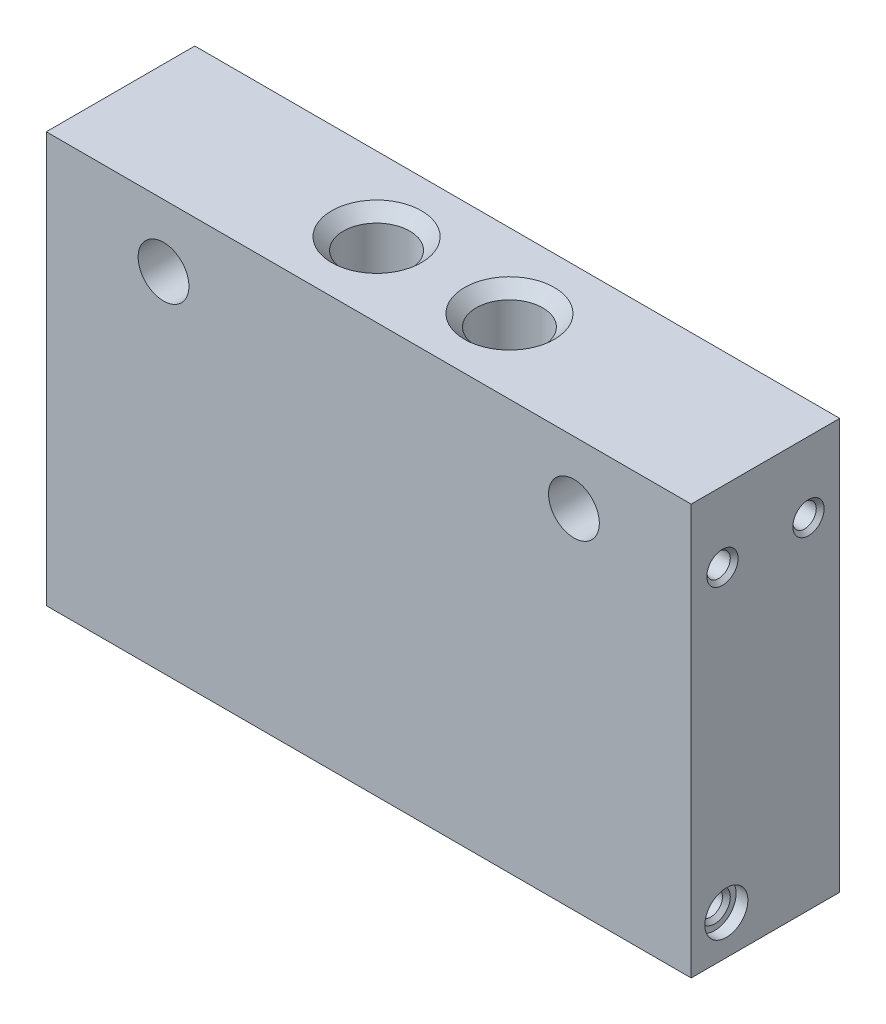
from build123d import *

# Parameters (mm, degrees)
SKETCH1_W                = 41.91
SKETCH1_H                = 9.652
BOSS_EXTRUDE1_DEPTH      = 26.67
SKETCH2_R                = 1.651
CUT_EXTRUDE1_DEPTH       = 51.605316954
SKETCH3_R                = 2.159
CUT_EXTRUDE2_DEPTH       = 6.35
CHAMFER5_SIZE            = 0.762
SKETCH5_R                = 2.159
CUT_EXTRUDE4_DEPTH       = 5.08
SKETCH6_R                = 2.921
CUT_EXTRUDE5_DEPTH       = 0.762
CHAMFER2_SIZE            = 0.762
SKETCH7_R                = 0.762
CUT_EXTRUDE6_DEPTH       = 5.334
SKETCH9_R                = 1.016
CUT_EXTRUDE7_DEPTH       = 1.27
SKETCH10_R               = 1.397
CUT_EXTRUDE8_DEPTH       = 0.762
CHAMFER3_SIZE            = 0.508
CHAMFER3_OF_MIRROR2_SIZE = 0.508
SKETCH12_R               = 0.762
CUT_EXTRUDE9_DEPTH       = 4.572
SKETCH14_R               = 1.016
CUT_EXTRUDE10_DEPTH      = 0.254
CHAMFER4_SIZE            = 0.254
CHAMFER4_OF_MIRROR3_SIZE = 0.254


# Some blends are built 0.0001 mm under size
with BuildPart() as part:
    # Sketch1 → Boss-Extrude1 (new body)
    with BuildSketch(Plane(origin=(0, 0, 0), x_dir=(1, 0, 0), z_dir=(0, 1, 0))):
        with Locations((20.955, 4.826)):
            Rectangle(SKETCH1_W, SKETCH1_H)
    extrude(amount=BOSS_EXTRUDE1_DEPTH)

    # Sketch2 → Cut-Extrude1 (cut, through all)
    with BuildSketch(Plane.XY):
        with Locations((34.29, 22.606)):
            Circle(SKETCH2_R)
        with Locations(Location((7.62, 22.606, 0), (0, 0, 180))):
            Circle(SKETCH2_R)
    extrude(amount=-CUT_EXTRUDE1_DEPTH, mode=Mode.SUBTRACT)

    # Sketch3 → Cut-Extrude2 (cut)
    with BuildSketch(Plane(origin=(0, 26.67, 0), x_dir=(1, 0, 0), z_dir=(0, 1, 0))):
        with Locations(Location((25.273, 4.826, 0), (0, 0, 270))):
            Circle(SKETCH3_R)
        with Locations(Location((16.637, 4.826, 0), (0, 0, 90))):
            Circle(SKETCH3_R)
    extrude(amount=-CUT_EXTRUDE2_DEPTH, mode=Mode.SUBTRACT)

    # Chamfer5
    chamfer5_edges = [part.edges().sort_by_distance(p)[0] for p in [
        (25.273, 26.67, -6.985),
        (16.637, 26.67, -2.667),
    ]]
    chamfer(chamfer5_edges, length=CHAMFER5_SIZE)

    # Sketch5 → Cut-Extrude4 (cut)
    with BuildSketch(Plane(origin=(0, 0, 0), x_dir=(-1, 0, 0), z_dir=(0, -1, 0))):
        with Locations(Location((-33.401, 4.826, 0), (0, 0, 90))):
            Circle(SKETCH5_R)
        with Locations(Location((-8.509, 4.826, 0), (0, 0, 270))):
            Circle(SKETCH5_R)
        with Locations(Location((-20.955, 4.826, 0), (0, 0, 90))):
            Circle(SKETCH5_R)
    extrude(amount=-CUT_EXTRUDE4_DEPTH, mode=Mode.SUBTRACT)

    # Sketch6 → Cut-Extrude5 (cut)
    with BuildSketch(Plane(origin=(0, 0, 0), x_dir=(-1, 0, 0), z_dir=(0, -1, 0))):
        with Locations(Location((-33.401, 4.826, 0), (0, 0, 90))):
            Circle(SKETCH6_R)
        with Locations(Location((-20.955, 4.826, 0), (0, 0, 90))):
            Circle(SKETCH6_R)
        with Locations(Location((-8.509, 4.826, 0), (0, 0, 90))):
            Circle(SKETCH6_R)
    extrude(amount=-CUT_EXTRUDE5_DEPTH, mode=Mode.SUBTRACT)

    # Chamfer2
    chamfer2_edges = [part.edges().sort_by_distance(p)[0] for p in [
        (33.401, 0.762, -1.905),
        (20.955, 0.762, -1.905),
        (8.509, 0.762, -1.905),
    ]]
    chamfer(chamfer2_edges, length=CHAMFER2_SIZE - 0.0001)  # a hair under: the kernel refuses the full size

    # Sketch7 → Cut-Extrude6 (cut)
    with BuildSketch(Plane(origin=(41.91, 0, 0), x_dir=(0, 0, -1), z_dir=(1, 0, 0))):
        with Locations((2.286, 2.54)):
            Circle(SKETCH7_R)
    cut_extrude6 = extrude(amount=-CUT_EXTRUDE6_DEPTH, mode=Mode.SUBTRACT)

    # Sketch9 → Cut-Extrude7 (cut)
    with BuildSketch(Plane(origin=(41.91, 0, 0), x_dir=(0, 0, -1), z_dir=(1, 0, 0))):
        with Locations((2.286, 2.54)):
            Circle(SKETCH9_R)
    cut_extrude7 = extrude(amount=-CUT_EXTRUDE7_DEPTH, mode=Mode.SUBTRACT)

    # Sketch10 → Cut-Extrude8 (cut)
    with BuildSketch(Plane(origin=(41.91, 0, 0), x_dir=(0, 0, -1), z_dir=(1, 0, 0))):
        with Locations((2.286, 2.54)):
            Circle(SKETCH10_R)
    cut_extrude8 = extrude(amount=-CUT_EXTRUDE8_DEPTH, mode=Mode.SUBTRACT)

    # Chamfer3
    # the kernel refuses this chamfer: 0.508 mm, written as the material it adds along each edge
    with BuildSketch(Plane(origin=(40.64, 2.54, -2.286), x_dir=(0, 0, -1), z_dir=(0, -1, 0))) as chamfer3_piece_1_section:
        Polygon((1.016, CHAMFER3_SIZE), (1.016 - CHAMFER3_SIZE, 0), (1.016, 0), align=None)
    chamfer3_piece_1 = revolve(axis=Axis((40.64, 2.54, -2.286), (1, 0, 0)), mode=Mode.PRIVATE)
    chamfer3_piece_1 = split(chamfer3_piece_1, bisect_by=Plane(origin=(41.148, 2.54, -1.391029136), z_dir=(-1, 0, 0)), keep=Keep.TOP, mode=Mode.PRIVATE)
    chamfer3_piece_1 = chamfer3_piece_1 - Plane(origin=(41.015029136, 2.54, -2.286), x_dir=(0, 0, -1), z_dir=(1, 0, 0)) * Cylinder(0.762, 5, mode=Mode.PRIVATE)
    add(chamfer3_piece_1)

    # Mirror2: Cut-Extrude6, Cut-Extrude7, Cut-Extrude8 across plane
    add(cut_extrude6.mirror(Plane.ZY.offset(-20.955)), mode=Mode.SUBTRACT)
    add(cut_extrude7.mirror(Plane.ZY.offset(-20.955)), mode=Mode.SUBTRACT)
    add(cut_extrude8.mirror(Plane.ZY.offset(-20.955)), mode=Mode.SUBTRACT)

    # Chamfer3 of Mirror2
    # the kernel refuses this chamfer: 0.508 mm, written as the material it adds along each edge
    with BuildSketch(Plane(origin=(1.27, 2.54, -2.286), x_dir=(0, 0, -1), z_dir=(0, -1, 0))) as chamfer3_of_mirror2_piece_1_section:
        Polygon((1.016, -CHAMFER3_OF_MIRROR2_SIZE), (1.016 - CHAMFER3_OF_MIRROR2_SIZE, 0), (1.016, 0), align=None)
    chamfer3_of_mirror2_piece_1 = revolve(axis=Axis((1.27, 2.54, -2.286), (1, 0, 0)), mode=Mode.PRIVATE)
    chamfer3_of_mirror2_piece_1 = split(chamfer3_of_mirror2_piece_1, bisect_by=Plane(origin=(0.762, 2.54, -1.391029136), z_dir=(1, 0, 0)), keep=Keep.TOP, mode=Mode.PRIVATE)
    chamfer3_of_mirror2_piece_1 = chamfer3_of_mirror2_piece_1 - Plane(origin=(0.894970864, 2.54, -2.286), x_dir=(0, 0, -1), z_dir=(-1, 0, 0)) * Cylinder(0.762, 5, mode=Mode.PRIVATE)
    add(chamfer3_of_mirror2_piece_1)

    # Sketch12 → Cut-Extrude9 (cut)
    with BuildSketch(Plane.ZY):
        with Locations((-2.032, 22.098)):
            Circle(SKETCH12_R)
        with Locations(Location((-7.62, 22.098, 0), (0, 0, 180))):
            Circle(SKETCH12_R)
    cut_extrude9 = extrude(amount=-CUT_EXTRUDE9_DEPTH, mode=Mode.SUBTRACT)

    # Sketch14 → Cut-Extrude10 (cut)
    with BuildSketch(Plane.ZY):
        with Locations((-7.62, 22.098)):
            Circle(SKETCH14_R)
        with Locations((-2.032, 22.098)):
            Circle(SKETCH14_R)
    cut_extrude10 = extrude(amount=-CUT_EXTRUDE10_DEPTH, mode=Mode.SUBTRACT)

    # Chamfer4
    chamfer4_edges = [part.edges().sort_by_distance(p)[0] for p in [
        (0.254, 22.098, -8.636),
        (0.254, 22.098, -3.048),
    ]]
    chamfer(chamfer4_edges, length=CHAMFER4_SIZE - 0.0001)  # a hair under: the kernel refuses the full size

    # Mirror3: Cut-Extrude9, Cut-Extrude10 across plane
    add(cut_extrude9.mirror(Plane.ZY.offset(-20.955)), mode=Mode.SUBTRACT)
    add(cut_extrude10.mirror(Plane.ZY.offset(-20.955)), mode=Mode.SUBTRACT)

    # Chamfer4 of Mirror3
    chamfer4_of_mirror3_edges = [part.edges().sort_by_distance(p)[0] for p in [
        (41.656, 22.098, -8.636),
        (41.656, 22.098, -3.048),
    ]]
    chamfer(chamfer4_of_mirror3_edges, length=CHAMFER4_OF_MIRROR3_SIZE - 0.0001)  # a hair under: the kernel refuses the full size


solid = part.part
